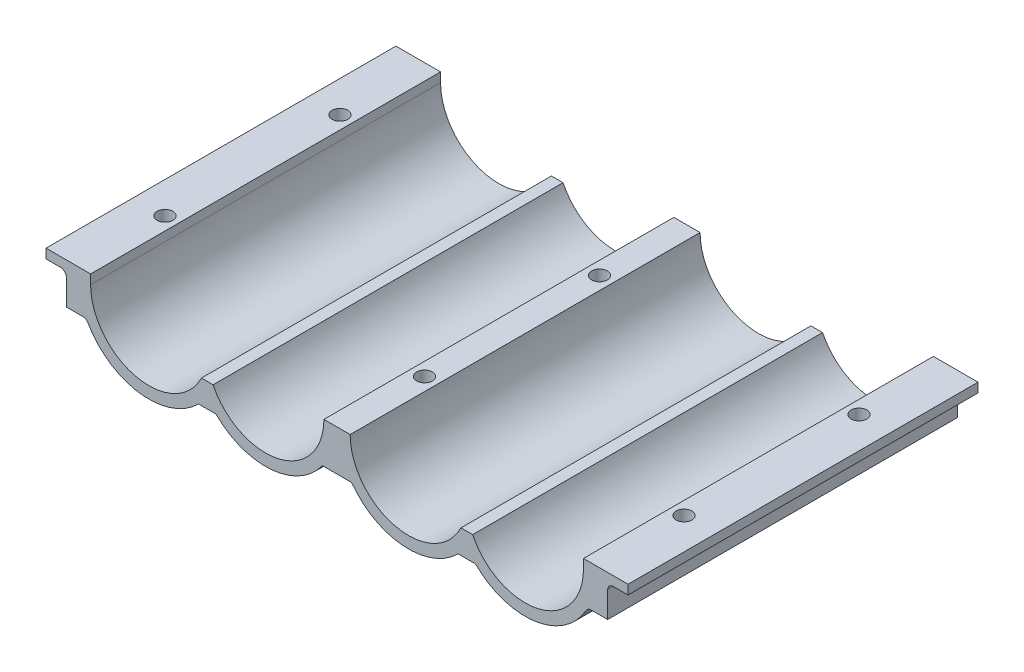
from build123d import *

# Parameters (mm, degrees)
BOSS_EXTRUDE1_DEPTH                  = 60
FILLET1_R                            = 1
F_2_7_START                          = -7
F_2_7_2_7_DIAMETER_HOLE1_OUTLINE_R   = 1.35
F_2_7_2_7_DIAMETER_HOLE1_DEPTH       = 7
F_2_7_START_2                        = -8.6
F_2_7_2_7_DIAMETER_HOLE1_2_OUTLINE_R = 1.35
F_2_7_2_7_DIAMETER_HOLE1_2_DEPTH     = 1.6


# Read off the part's stored shape, not the designer's step: Ø2.7 (2.7) Diameter Hole1
with BuildPart() as part:
    # Sketch1 → Boss-Extrude1 (new body)
    with BuildSketch(Plane.XY):
        with BuildLine():
            Line((0, 0), (7.65, 0))
            Line((7.65, 0), (7.65, -1.6))
            ThreePointArc((7.65, -1.6), (15.413932023, -11.346794345), (26.65, -5.958898944))
            Line((26.65, -5.958898944), (28.65, -5.958898944))
            ThreePointArc((28.65, -5.958898944), (39.886067977, -11.346794345), (47.65, -1.6))
            Line((47.65, -1.6), (52.15, -1.6))
            ThreePointArc((52.15, -1.6), (59.913932023, -11.346794345), (71.15, -5.958898944))
            Line((71.15, -5.958898944), (73.15, -5.958898944))
            ThreePointArc((73.15, -5.958898944), (84.386067977, -11.346794345), (92.15, -1.6))
            Line((92.15, -1.6), (92.15, 0))
            Line((92.15, 0), (99.8, 0))
            Line((99.8, 0), (99.8, -1.6))
            Line((99.8, -1.6), (96.3, -1.6))
            Line((96.3, -1.6), (96.3, -7))
            Line((96.3, -7), (92.86634266, -7))
            ThreePointArc((92.86634266, -7), (84.043434268, -13.449679602), (73.65, -10.070537173))
            Line((73.65, -10.070537173), (70.65, -10.070537173))
            ThreePointArc((70.65, -10.070537173), (61.186027008, -13.561218837), (52.403205655, -8.6))
            Line((52.403205655, -8.6), (47.396794345, -8.6))
            ThreePointArc((47.396794345, -8.6), (38.613972992, -13.561218837), (29.15, -10.070537173))
            Line((29.15, -10.070537173), (26.15, -10.070537173))
            ThreePointArc((26.15, -10.070537173), (15.756565732, -13.449679602), (6.93365734, -7))
            Line((6.93365734, -7), (3.5, -7))
            Line((3.5, -7), (3.5, -1.6))
            Line((3.5, -1.6), (0, -1.6))
            Line((0, -1.6), (0, 0))
        make_face()
    extrude(amount=BOSS_EXTRUDE1_DEPTH)

    # Fillet1
    fillet1_edges = [part.edges().sort_by_distance(p)[0] for p in [
        (96.3, -1.6, 30),
        (92.86634266, -7, 30),
        (6.93365734, -7, 30),
        (3.5, -1.6, 30),
    ]]
    fillet(fillet1_edges, radius=FILLET1_R)

    # Ø2.7 (2.7) Diameter Hole1 outline → Ø2.7 (2.7) Diameter Hole1 (cut)
    with BuildSketch(Plane(origin=(0, 0, 0), x_dir=(1, 0, 0), z_dir=(0, 1, 0)).offset(F_2_7_START)):
        with Locations((94.4, -15)):
            Circle(F_2_7_2_7_DIAMETER_HOLE1_OUTLINE_R)
        with Locations((94.4, -45)):
            Circle(F_2_7_2_7_DIAMETER_HOLE1_OUTLINE_R)
        with Locations((49.9, -15)):
            Circle(F_2_7_2_7_DIAMETER_HOLE1_OUTLINE_R)
        with Locations((49.9, -45)):
            Circle(F_2_7_2_7_DIAMETER_HOLE1_OUTLINE_R)
    f_2_7_2_7_diameter_hole1 = extrude(amount=F_2_7_2_7_DIAMETER_HOLE1_DEPTH, mode=Mode.SUBTRACT)

    # 2.7 _2.7_ Diameter Hole1 2 outline → 2.7 _2.7_ Diameter Hole1 2 (cut)
    with BuildSketch(Plane(origin=(0, 0, 0), x_dir=(1, 0, 0), z_dir=(0, 1, 0)).offset(F_2_7_START_2)):
        with Locations((49.9, -15)):
            Circle(F_2_7_2_7_DIAMETER_HOLE1_2_OUTLINE_R)
        with Locations((49.9, -45)):
            Circle(F_2_7_2_7_DIAMETER_HOLE1_2_OUTLINE_R)
    f_2_7_2_7_diameter_hole1_2 = extrude(amount=F_2_7_2_7_DIAMETER_HOLE1_2_DEPTH, mode=Mode.SUBTRACT)

    # Mirror1: Ø2.7 (2.7) Diameter Hole1, 2.7 _2.7_ Diameter Hole1 2 across plane
    add(f_2_7_2_7_diameter_hole1.mirror(Plane.ZY.offset(-49.9)), mode=Mode.SUBTRACT)
    add(f_2_7_2_7_diameter_hole1_2.mirror(Plane.ZY.offset(-49.9)), mode=Mode.SUBTRACT)


solid = part.part
